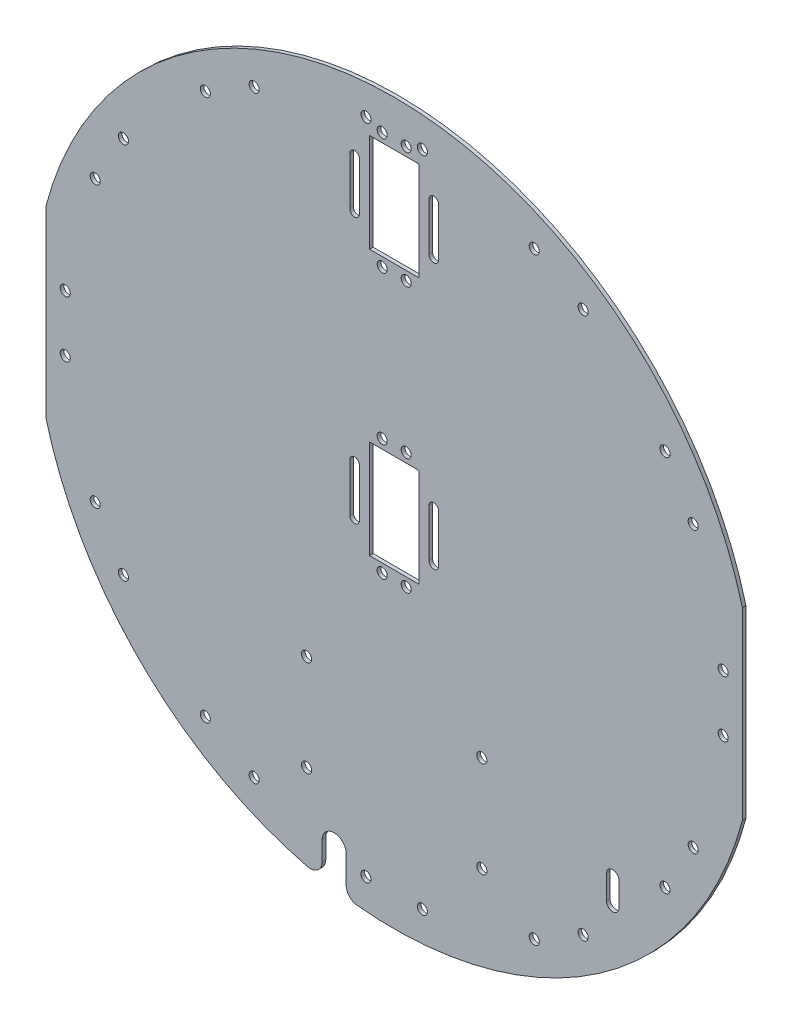
from build123d import *

# Parameters (mm, degrees)
SM_BASE_FLANGE_1_OUTLINE_R = 2.1
SM_BASE_FLANGE_1_DEPTH     = 1.5
CUT_EXTRUDE_2_DEPTH        = 1.5
FILLET_1_R                 = 5
SKETCH_8_R                 = 2.1
CUT_EXTRUDE_5_DEPTH        = 1.5


# Read off the part's stored shape, not the designer's step: 基体-法兰1
with BuildPart() as part:
    # 基体-法兰1 outline → 基体-法兰1 (new body)
    with BuildSketch(Plane.XY):
        with BuildLine():
            ThreePointArc((-20, -148.660687473), (83.338400401, -124.718527167), (145, -38.405728739))
            Line((145, -38.405728739), (145, 38.405728739))
            ThreePointArc((145, 38.405728739), (0, 150), (-145, 38.405728739))
            Line((-145, 38.405728739), (-145, -38.405728739))
            ThreePointArc((-145, -38.405728739), (-102.969737504, -109.074438611), (-30, -146.969384567))
            Line((-30, -146.969384567), (-30, -132.817748132))
            ThreePointArc((-30, -132.817748132), (-25, -127.817748132), (-20, -132.817748132))
            Line((-20, -132.817748132), (-20, -148.660687473))
        make_face()
        with Locations((-36.5, -110)):
            Circle(SM_BASE_FLANGE_1_OUTLINE_R, mode=Mode.SUBTRACT)
        with Locations((-36.5, -70)):
            Circle(SM_BASE_FLANGE_1_OUTLINE_R, mode=Mode.SUBTRACT)
        with Locations((-5, -24.121330526)):
            Circle(SM_BASE_FLANGE_1_OUTLINE_R, mode=Mode.SUBTRACT)
        with BuildLine():
            Line((-14.5, 10), (-14.5, -10))
            ThreePointArc((-14.5, -10), (-16.5, -12), (-18.5, -10))
            Line((-18.5, -10), (-18.5, 10))
            ThreePointArc((-18.5, 10), (-16.5, 12), (-14.5, 10))
        make_face(mode=Mode.SUBTRACT)
        with Locations((36.5, -110)):
            Circle(SM_BASE_FLANGE_1_OUTLINE_R, mode=Mode.SUBTRACT)
        with Locations((36.5, -70)):
            Circle(SM_BASE_FLANGE_1_OUTLINE_R, mode=Mode.SUBTRACT)
        with Locations((5, -24.132256214)):
            Circle(SM_BASE_FLANGE_1_OUTLINE_R, mode=Mode.SUBTRACT)
        Polygon((-10.25, 20.500012235), (10.250024471, 20.522409895), (10.25, -20.522409895), (-10.25, -20.500012235), align=None, mode=Mode.SUBTRACT)
        with BuildLine():
            Line((14.5, -10), (14.5, 10))
            ThreePointArc((14.5, 10), (16.5, 12), (18.5, 10))
            Line((18.5, 10), (18.5, -10))
            ThreePointArc((18.5, -10), (16.5, -12), (14.5, -10))
        make_face(mode=Mode.SUBTRACT)
        with Locations((-5, 24.378698421)):
            Circle(SM_BASE_FLANGE_1_OUTLINE_R, mode=Mode.SUBTRACT)
        with Locations((-5, 86.272395421)):
            Circle(SM_BASE_FLANGE_1_OUTLINE_R, mode=Mode.SUBTRACT)
        with BuildLine():
            Line((-14.5, 120.522409895), (-14.5, 100.522409895))
            ThreePointArc((-14.5, 100.522409895), (-16.5, 98.522409895), (-18.5, 100.522409895))
            Line((-18.5, 100.522409895), (-18.5, 120.522409895))
            ThreePointArc((-18.5, 120.522409895), (-16.5, 122.522409895), (-14.5, 120.522409895))
        make_face(mode=Mode.SUBTRACT)
        with Locations((-5, 134.772424369)):
            Circle(SM_BASE_FLANGE_1_OUTLINE_R, mode=Mode.SUBTRACT)
        with Locations((5, 24.367772734)):
            Circle(SM_BASE_FLANGE_1_OUTLINE_R, mode=Mode.SUBTRACT)
        with Locations((5, 86.261469734)):
            Circle(SM_BASE_FLANGE_1_OUTLINE_R, mode=Mode.SUBTRACT)
        Polygon((-10.25, 90.022397659), (-10.25, 131.02242213), (10.250024471, 131.04481979), (10.25, 90), align=None, mode=Mode.SUBTRACT)
        with BuildLine():
            Line((14.5, 100.522409895), (14.5, 120.522409895))
            ThreePointArc((14.5, 120.522409895), (16.5, 122.522409895), (18.5, 120.522409895))
            Line((18.5, 120.522409895), (18.5, 100.522409895))
            ThreePointArc((18.5, 100.522409895), (16.5, 98.522409895), (14.5, 100.522409895))
        make_face(mode=Mode.SUBTRACT)
        with Locations((5, 134.761498681)):
            Circle(SM_BASE_FLANGE_1_OUTLINE_R, mode=Mode.SUBTRACT)
    extrude(amount=SM_BASE_FLANGE_1_DEPTH)

    # 草图3 → 切除-拉伸2 (cut)
    with BuildSketch(Plane(origin=(0, 0, 0), x_dir=(-1, 0, 0), z_dir=(0, 0, -1))):
        with BuildLine():
            Line((-93.6, -85.709487412), (-93.6, -95.709487412))
            ThreePointArc((-93.6, -95.709487412), (-91, -98.309487412), (-88.4, -95.709487412))
            Line((-88.4, -95.709487412), (-88.4, -85.709487412))
            ThreePointArc((-88.4, -85.709487412), (-91, -83.109487412), (-93.6, -85.709487412))
        make_face()
    extrude(amount=-CUT_EXTRUDE_2_DEPTH, mode=Mode.SUBTRACT)

    # 圆角1
    fillet_1_edges = [part.edges().sort_by_distance(p)[0] for p in [
        (-20, -148.660687473, 0.75),
        (-30, -146.969384567, 0.75),
    ]]
    fillet(fillet_1_edges, radius=FILLET_1_R)

    # 草图8 → 切除-拉伸5 (cut)
    with BuildSketch(Plane.XY.offset(1.5)):
        with Locations(Location((112.770480318, -78.675798494, 0), (0, 0, 180))):
            Circle(SKETCH_8_R)
        with Locations((137, 11.75)):
            Circle(SKETCH_8_R)
        with Locations(Location((137, -11.75, 0), (0, 0, 180))):
            Circle(SKETCH_8_R)
        with Locations((124.520480318, -58.324201506)):
            Circle(SKETCH_8_R)
        with Locations(Location((58.324201506, -124.520480318, 0), (0, 0, 180))):
            Circle(SKETCH_8_R)
        with Locations((78.675798494, -112.770480318)):
            Circle(SKETCH_8_R)
        with Locations(Location((-11.75, -137, 0), (0, 0, 180))):
            Circle(SKETCH_8_R)
        with Locations((11.75, -137)):
            Circle(SKETCH_8_R)
        with Locations(Location((-78.675798494, -112.770480318, 0), (0, 0, 180))):
            Circle(SKETCH_8_R)
        with Locations((-58.324201506, -124.520480318)):
            Circle(SKETCH_8_R)
        with Locations(Location((-124.520480318, -58.324201506, 0), (0, 0, 180))):
            Circle(SKETCH_8_R)
        with Locations((-112.770480318, -78.675798494)):
            Circle(SKETCH_8_R)
        with Locations(Location((-137, 11.75, 0), (0, 0, 180))):
            Circle(SKETCH_8_R)
        with Locations((-137, -11.75)):
            Circle(SKETCH_8_R)
        with Locations(Location((-112.770480318, 78.675798494, 0), (0, 0, 180))):
            Circle(SKETCH_8_R)
        with Locations((-124.520480318, 58.324201506)):
            Circle(SKETCH_8_R)
        with Locations(Location((-58.324201506, 124.520480318, 0), (0, 0, 180))):
            Circle(SKETCH_8_R)
        with Locations((-78.675798494, 112.770480318)):
            Circle(SKETCH_8_R)
        with Locations(Location((11.75, 137, 0), (0, 0, 180))):
            Circle(SKETCH_8_R)
        with Locations((-11.75, 137)):
            Circle(SKETCH_8_R)
        with Locations(Location((78.675798494, 112.770480318, 0), (0, 0, 180))):
            Circle(SKETCH_8_R)
        with Locations((58.324201506, 124.520480318)):
            Circle(SKETCH_8_R)
        with Locations(Location((124.520480318, 58.324201506, 0), (0, 0, 180))):
            Circle(SKETCH_8_R)
        with Locations((112.770480318, 78.675798494)):
            Circle(SKETCH_8_R)
    extrude(amount=-CUT_EXTRUDE_5_DEPTH, mode=Mode.SUBTRACT)


solid = part.part
